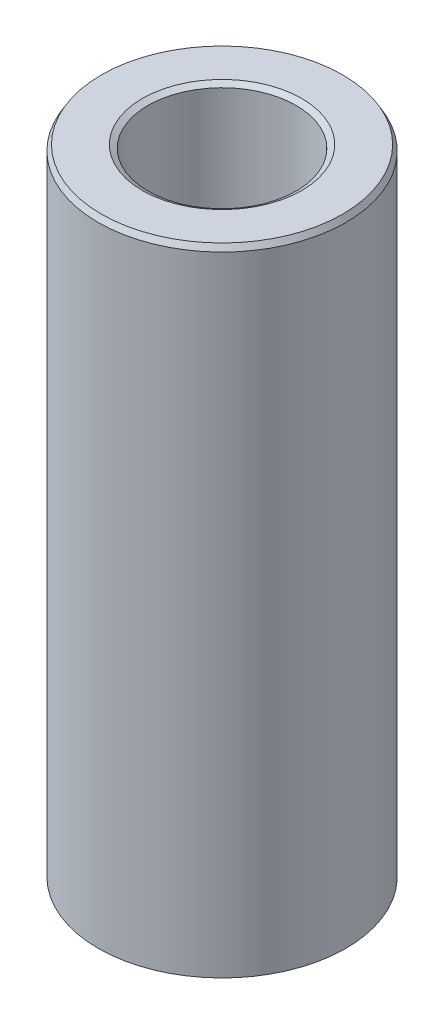
from build123d import *
from OCP.BRepFilletAPI import BRepFilletAPI_MakeChamfer

# Parameters (mm, degrees)
SKETCH1_R           = 55
BOSS_EXTRUDE1_DEPTH = 283.047277922
SKETCH2_R           = 32.91694955
CUT_EXTRUDE1_DEPTH  = 294.540050997
CHAMFER1_SIZE       = 2.48597486
CHAMFER1_SIZE2      = 1.435278255


with BuildPart() as part:
    # Sketch1 → Boss-Extrude1 (new body)
    with BuildSketch(Plane(origin=(0, 0, 0), x_dir=(1, 0, 0), z_dir=(0, 1, 0))):
        Circle(SKETCH1_R)
    extrude(amount=BOSS_EXTRUDE1_DEPTH)

    # Sketch2 → Cut-Extrude1 (cut, through all)
    with BuildSketch(Plane(origin=(0, 0, 0), x_dir=(1, 0, 0), z_dir=(0, 1, 0))):
        Circle(SKETCH2_R)
    extrude(amount=CUT_EXTRUDE1_DEPTH, mode=Mode.SUBTRACT)

    # Chamfer1: one chamfer whose edges measure the first distance from different faces: ONE call of the kernel's chamfer builder (chamfer() names one face for all edges)
    chamfer1_edges_1 = [part.edges().sort_by_distance(p)[0] for p in [
        (-32.91694955, 283.047277922, 0),
    ]]
    chamfer1_side_1 = [part.faces().sort_by_distance(p)[0] for p in [
        (-53.444365081, 283.047277922, 0),
    ]]
    chamfer1_edges_2 = [part.edges().sort_by_distance(p)[0] for p in [
        (-32.91694955, 0, 0),
    ]]
    chamfer1_side_2 = [part.faces().sort_by_distance(p)[0] for p in [
        (-32.91694955, 141.523638961, 0),
    ]]
    chamfer1_edges_3 = [part.edges().sort_by_distance(p)[0] for p in [
        (-55, 0, 0),
    ]]
    chamfer1_side_3 = [part.faces().sort_by_distance(p)[0] for p in [
        (-53.444365081, 0, 0),
    ]]
    chamfer1_edges_4 = [part.edges().sort_by_distance(p)[0] for p in [
        (-55, 283.047277922, 0),
    ]]
    chamfer1_side_4 = [part.faces().sort_by_distance(p)[0] for p in [
        (-55, 141.523638961, 0),
    ]]
    chamfer1 = BRepFilletAPI_MakeChamfer(part.part.solid().wrapped)
    for e in chamfer1_edges_1:
        chamfer1.Add(CHAMFER1_SIZE, CHAMFER1_SIZE2, e.wrapped, chamfer1_side_1[0].wrapped)  # the first distance lies on this face
    for e in chamfer1_edges_2:
        chamfer1.Add(CHAMFER1_SIZE, CHAMFER1_SIZE2, e.wrapped, chamfer1_side_2[0].wrapped)  # the first distance lies on this face
    for e in chamfer1_edges_3:
        chamfer1.Add(CHAMFER1_SIZE, CHAMFER1_SIZE2, e.wrapped, chamfer1_side_3[0].wrapped)  # the first distance lies on this face
    for e in chamfer1_edges_4:
        chamfer1.Add(CHAMFER1_SIZE, CHAMFER1_SIZE2, e.wrapped, chamfer1_side_4[0].wrapped)  # the first distance lies on this face
    add(Compound.cast(chamfer1.Shape()), mode=Mode.REPLACE)


solid = part.part
